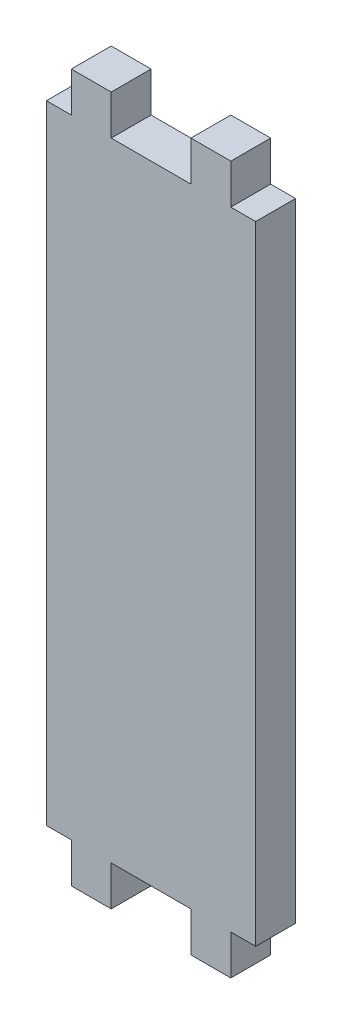
from build123d import *

# Parameters (mm, degrees)
SKETCH1_W           = 26.66
SKETCH1_H           = 79.98
BOSS_EXTRUDE1_DEPTH = 5.08
SKETCH3_W           = 5.08
SKETCH3_H           = 5.08
BOSS_EXTRUDE2_DEPTH = 5.08


with BuildPart() as part:
    # Sketch1 → Boss-Extrude1 (new body)
    with BuildSketch(Plane.XY):
        with Locations((62.93, -5.8125)):
            Rectangle(SKETCH1_W, SKETCH1_H)
    extrude(amount=BOSS_EXTRUDE1_DEPTH)

    # Sketch3 → Boss-Extrude2 (add)
    with BuildSketch(Plane.XY.offset(5.08)):
        with Locations((55.31, -48.3425)):
            Rectangle(SKETCH3_W, SKETCH3_H)
        with Locations((70.55, 36.7175)):
            Rectangle(SKETCH3_W, SKETCH3_H)
        with Locations((55.31, 36.7175)):
            Rectangle(SKETCH3_W, SKETCH3_H)
        with Locations((70.55, -48.3425)):
            Rectangle(SKETCH3_W, SKETCH3_H)
    extrude(amount=-BOSS_EXTRUDE2_DEPTH)


solid = part.part
